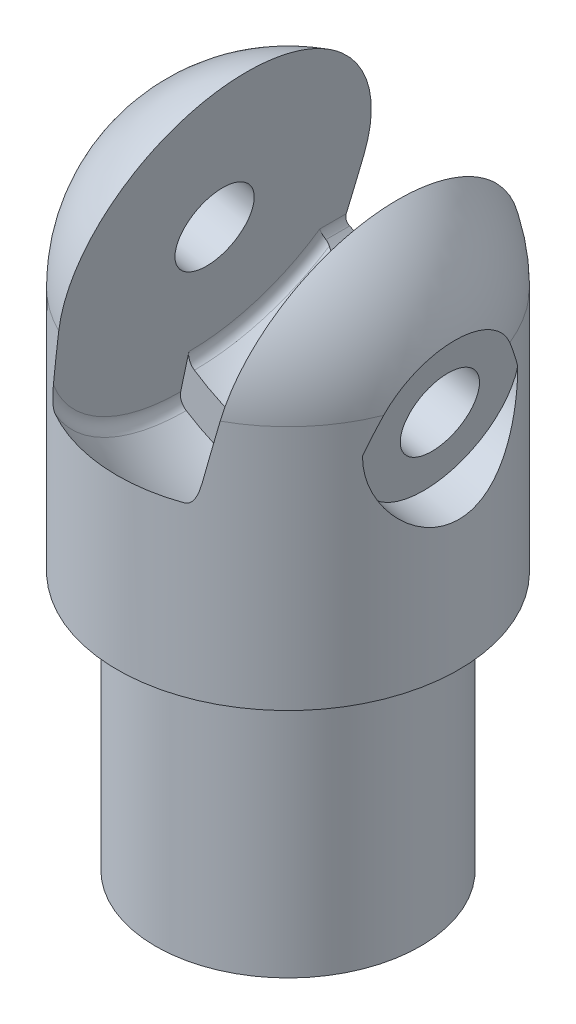
from build123d import *

# Parameters (mm, degrees)
SKETCH1_R                     = 12.9921
BOSS_EXTRUDE1_DEPTH           = 25.4
CUT_EXTRUDE1_DEPTH            = 104.344307451
CUT_EXTRUDE1_DEPTH_BACK       = 104.344307451
SKETCH3_R                     = 3.81
CUT_REVOLVE10_ANGLE           = 90
CUT_REVOLVE10_OTHER_WAY_ANGLE = 180
CUT_EXTRUDE4_DEPTH            = 32.004
FILLET1_R                     = 1.27
SKETCH15_R                    = 7.62
CUT_EXTRUDE5_DEPTH            = 10.16


with BuildPart() as part:
    # Sketch1 → Boss-Extrude1 (new body)
    with BuildSketch(Plane(origin=(0, 0, 0), x_dir=(1, 0, 0), z_dir=(0, 1, 0))):
        Circle(SKETCH1_R)
    extrude(amount=BOSS_EXTRUDE1_DEPTH)

    # Sketch2 → Revolve1 (revolve)
    with BuildSketch(Plane(origin=(0, 0, 0), x_dir=(0, 0, -1), z_dir=(1, 0, 0))):
        with BuildLine():
            Line((-16.764, 25.4), (-16.764, 49.53))
            ThreePointArc((-16.764, 49.53), (-11.85393808, 61.38393808), (0, 66.294))
            Line((0, 66.294), (0, 25.4))
            Line((0, 25.4), (-16.764, 25.4))
        make_face()
    revolve(axis=Axis((0, 25.4, 0), (0, 1, 0)))

    # Sketch3 → Cut-Extrude1 (cut, two sides: drawn at the far end of the back side and taken through both)
    with BuildSketch(Plane(origin=(10.366451402, 98.300319395, 0), x_dir=(0, 0, -1), z_dir=(-0.9781476007338048, 0.20791169081776326, 0)).offset(-CUT_EXTRUDE1_DEPTH_BACK)):
        with Locations((0, 49.859877342)):
            Circle(SKETCH3_R)
    extrude(amount=CUT_EXTRUDE1_DEPTH + CUT_EXTRUDE1_DEPTH_BACK, mode=Mode.SUBTRACT)

    # Sketch11 → Cut-Revolve10 (revolve, cut)
    with BuildSketch(Plane.XY):
        with BuildLine():
            Line((-7.205035227, 51.061477515), (-3.695979409, 67.570287171))
            ThreePointArc((-3.695979409, 67.570287171), (4.101170935, 67.482510185), (11.162976054, 64.175825024))
            Line((11.162976054, 64.175825024), (7.701934208, 47.892903347))
            Line((7.701934208, 47.892903347), (-7.205035227, 51.061477515))
        make_face()
    revolve(axis=Axis((14.591159488, 46.428553308, 0), (-0.9781476007338048, 0.20791169081776337, 0)), revolution_arc=CUT_REVOLVE10_ANGLE, mode=Mode.SUBTRACT)

    # Sketch11 → Cut-Revolve10 other way (revolve, cut)
    with BuildSketch(Plane.XY):
        with BuildLine():
            Line((-7.205035227, 51.061477515), (-3.695979409, 67.570287171))
            ThreePointArc((-3.695979409, 67.570287171), (4.101170935, 67.482510185), (11.162976054, 64.175825024))
            Line((11.162976054, 64.175825024), (7.701934208, 47.892903347))
            Line((7.701934208, 47.892903347), (-7.205035227, 51.061477515))
        make_face()
    revolve(axis=Axis((14.591159488, 46.428553308, 0), (0.9781476007338048, -0.20791169081776337, 0)), revolution_arc=CUT_REVOLVE10_OTHER_WAY_ANGLE, mode=Mode.SUBTRACT)

    # Sketch13 → Cut-Revolve11 (revolve, cut)
    with BuildSketch(Plane.XY):
        with BuildLine():
            Line((-6.412891685, 54.788219873), (8.49407775, 51.619645705))
            Line((8.49407775, 51.619645705), (11.979609352, 68.017782626))
            ThreePointArc((11.979609352, 68.017782626), (4.869286819, 71.216520857), (-2.927360083, 71.186356794))
            Line((-2.927360083, 71.186356794), (-6.412891685, 54.788219873))
        make_face()
    revolve(axis=Axis((-6.412891685, 54.788219873, 0), (0.9781476007338048, -0.20791169081776317, 0)), mode=Mode.SUBTRACT)

    # Sketch14 → Cut-Extrude4 (cut)
    with BuildSketch(Plane.XY):
        with BuildLine():
            Line((-7.205035227, 51.061477515), (-8.757313212, 43.758583769))
            ThreePointArc((-8.757313212, 43.758583769), (-1.969552427, 39.042311826), (6.149656223, 40.590009601))
            Line((6.149656223, 40.590009601), (7.701934208, 47.892903347))
            Line((7.701934208, 47.892903347), (-7.205035227, 51.061477515))
        make_face()
    extrude(amount=-CUT_EXTRUDE4_DEPTH, mode=Mode.SUBTRACT)

    # Fillet1
    fillet1_edges = [part.edges().sort_by_distance(p)[0] for p in [
        (-10.298585015, 36.507470038, 7.966497668),
        (-9.600405282, 39.79214743, -6.782727573),
        (-8.757313212, 43.758583769, -13.350191985),
        (6.149656223, 40.590009601, -14.000445211),
        (5.306564153, 36.623573262, -6.782727573),
        (4.840027967, 34.428693074, 9.361457334),
    ]]
    fillet(fillet1_edges, radius=FILLET1_R)

    # Sketch15 → Cut-Extrude5 (cut)
    with BuildSketch(Plane(origin=(-24.979802401, 5.30962091, 0), x_dir=(0, 0, -1), z_dir=(-0.9781476007338048, 0.20791169081776326, 0))):
        with Locations((0, -48.447650664)):
            Circle(SKETCH15_R)
    cut_extrude5 = extrude(amount=CUT_EXTRUDE5_DEPTH, mode=Mode.SUBTRACT)

    # Mirror1: Cut-Extrude5 across plane
    add(cut_extrude5.mirror(Plane(origin=(-10.072832966, 2.141046741, 0), x_dir=(0, 0, 1), z_dir=(-0.9781476007338048, 0.20791169081776326, 0))), mode=Mode.SUBTRACT)


solid = part.part
